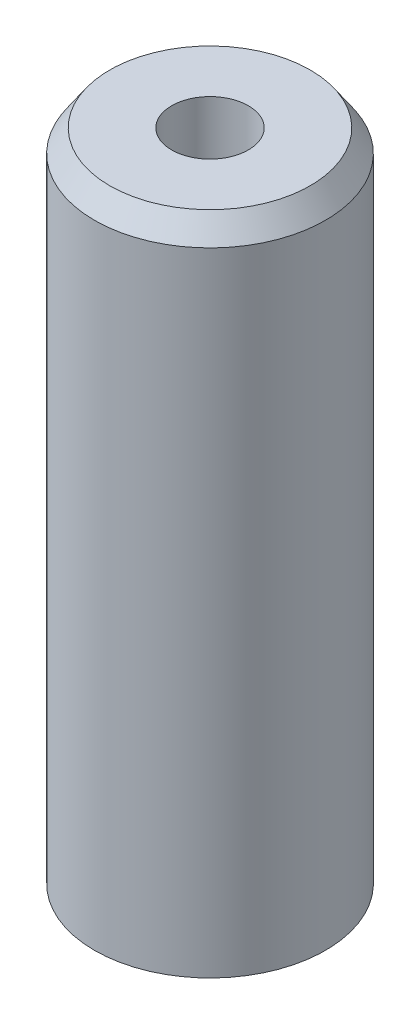
from build123d import *
from OCP.BRepFilletAPI import BRepFilletAPI_MakeChamfer

# Parameters (mm, degrees)
SKETCH1_R           = 27.5
BOSS_EXTRUDE1_DEPTH = 159.441665289
SKETCH2_R           = 9.126958466
CUT_EXTRUDE1_DEPTH  = 165.116253401
CHAMFER1_SIZE       = 5.309192097
CHAMFER1_SIZE2      = 3.630323187


with BuildPart() as part:
    # Sketch1 → Boss-Extrude1 (new body)
    with BuildSketch(Plane(origin=(0, 0, 0), x_dir=(1, 0, 0), z_dir=(0, 1, 0))):
        Circle(SKETCH1_R)
    extrude(amount=BOSS_EXTRUDE1_DEPTH)

    # Sketch2 → Cut-Extrude1 (cut, through all)
    with BuildSketch(Plane(origin=(0, 0, 0), x_dir=(1, 0, 0), z_dir=(0, 1, 0))):
        Circle(SKETCH2_R)
    extrude(amount=CUT_EXTRUDE1_DEPTH, mode=Mode.SUBTRACT)

    # Chamfer1: one chamfer whose edges measure the first distance from different faces: ONE call of the kernel's chamfer builder (chamfer() names one face for all edges)
    chamfer1_edges_1 = [part.edges().sort_by_distance(p)[0] for p in [
        (-27.5, 159.441665289, 0),
    ]]
    chamfer1_side_1 = [part.faces().sort_by_distance(p)[0] for p in [
        (-27.5, 79.720832645, 0),
    ]]
    chamfer1_edges_2 = [part.edges().sort_by_distance(p)[0] for p in [
        (-27.5, 0, 0),
    ]]
    chamfer1_side_2 = [part.faces().sort_by_distance(p)[0] for p in [
        (-26.722182541, 0, 0),
    ]]
    chamfer1 = BRepFilletAPI_MakeChamfer(part.part.solid().wrapped)
    for e in chamfer1_edges_1:
        chamfer1.Add(CHAMFER1_SIZE, CHAMFER1_SIZE2, e.wrapped, chamfer1_side_1[0].wrapped)  # the first distance lies on this face
    for e in chamfer1_edges_2:
        chamfer1.Add(CHAMFER1_SIZE, CHAMFER1_SIZE2, e.wrapped, chamfer1_side_2[0].wrapped)  # the first distance lies on this face
    add(Compound.cast(chamfer1.Shape()), mode=Mode.REPLACE)


solid = part.part
